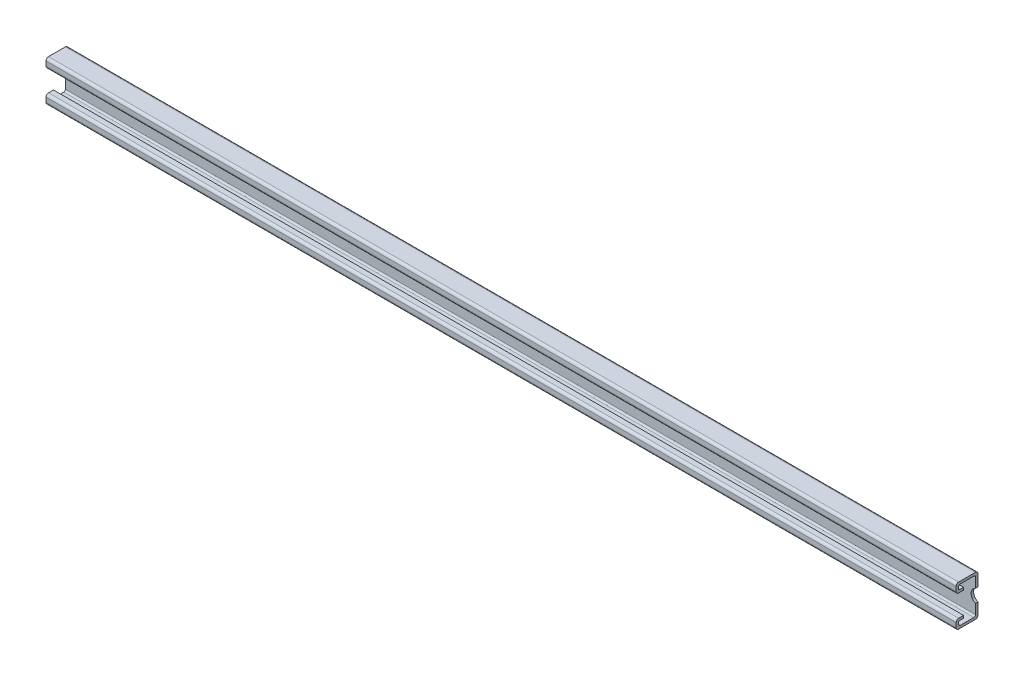
from build123d import *

# Parameters (mm, degrees)
SKETCH1_W           = 1000
SKETCH1_H           = 41
BOSS_EXTRUDE1_DEPTH = 22
CUT_EXTRUDE1_DEPTH  = 1001.900594465
SKETCH3_W           = 1000
SKETCH3_H           = 2.5
BOSS_EXTRUDE2_DEPTH = 5
CUT_EXTRUDE2_DEPTH  = 1002.08191473
CUT_EXTRUDE3_DEPTH  = 1002.08191473
CUT_EXTRUDE4_DEPTH  = 1002.08191473
CUT_EXTRUDE5_DEPTH  = 1002.08191473
CUT_EXTRUDE6_DEPTH  = 1002.08191473
CUT_EXTRUDE7_DEPTH  = 1002.08191473
CUT_EXTRUDE8_DEPTH  = 1002.08191473
CUT_EXTRUDE9_DEPTH  = 1002.08191473
CUT_EXTRUDE10_DEPTH = 1002.08191473
CUT_EXTRUDE11_DEPTH = 1002.08191473
CUT_EXTRUDE12_DEPTH = 1002.08191473
CUT_EXTRUDE13_DEPTH = 1002.08191473
CUT_EXTRUDE14_DEPTH = 1002.08191473
CUT_EXTRUDE15_DEPTH = 1002.08191473
CUT_EXTRUDE16_DEPTH = 1002.08191473
CUT_EXTRUDE17_DEPTH = 1002.08191473
CUT_EXTRUDE18_DEPTH = 1002.08191473
CUT_EXTRUDE19_DEPTH = 1002.08191473
CUT_EXTRUDE20_DEPTH = 1002.08191473
CUT_EXTRUDE21_DEPTH = 1002.08191473
FILLET1_R           = 1.2
FILLET2_R           = 1.6
FILLET3_R           = 2.5
SKETCH24_W          = 85.6
SKETCH24_H          = 22
CUT_EXTRUDE22_DEPTH = 1001.900594465


with BuildPart() as part:
    # Sketch1 → Boss-Extrude1 (new body)
    with BuildSketch(Plane(origin=(0, 0, -11), x_dir=(-1, 0, 0), z_dir=(0, 0, -1))):
        with Locations((-500, 20.5)):
            Rectangle(SKETCH1_W, SKETCH1_H)
    extrude(amount=-BOSS_EXTRUDE1_DEPTH)

    # Sketch2 → Cut-Extrude1 (cut, through all)
    with BuildSketch(Plane(origin=(1000, 0, 0), x_dir=(0, 0, -1), z_dir=(1, 0, 0))):
        Polygon((-11, 9.5), (-3.5, 9.5), (-3.5, 7), (-8.5, 7), (-8.5, 2.5), (8.5, 2.5), (8.5, 38.5), (-8.5, 38.5), (-8.5, 31.5), (-11, 31.5), align=None)
    extrude(amount=-CUT_EXTRUDE1_DEPTH, mode=Mode.SUBTRACT)

    # Sketch3 → Boss-Extrude2 (add)
    with BuildSketch(Plane(origin=(0, 0, 8.5), x_dir=(-1, 0, 0), z_dir=(0, 0, -1))):
        with Locations((-500, 32.75)):
            Rectangle(SKETCH3_W, SKETCH3_H)
    extrude(amount=BOSS_EXTRUDE2_DEPTH)

    # Sketch4 → Cut-Extrude2 (cut, through all)
    with BuildSketch(Plane(origin=(0, 0, -11), x_dir=(-1, 0, 0), z_dir=(0, 0, -1))):
        with BuildLine():
            Line((-117, 27.5), (-133, 27.5))
            ThreePointArc((-133, 27.5), (-140, 20.5), (-133, 13.5))
            Line((-133, 13.5), (-117, 13.5))
            ThreePointArc((-117, 13.5), (-110, 20.5), (-117, 27.5))
        make_face()
    extrude(amount=-CUT_EXTRUDE2_DEPTH, mode=Mode.SUBTRACT)

    # Sketch5 → Cut-Extrude3 (cut, through all)
    with BuildSketch(Plane(origin=(0, 0, -11), x_dir=(-1, 0, 0), z_dir=(0, 0, -1))):
        with BuildLine():
            Line((-217, 27.5), (-233, 27.5))
            ThreePointArc((-233, 27.5), (-240, 20.5), (-233, 13.5))
            Line((-233, 13.5), (-217, 13.5))
            ThreePointArc((-217, 13.5), (-210, 20.5), (-217, 27.5))
        make_face()
    extrude(amount=-CUT_EXTRUDE3_DEPTH, mode=Mode.SUBTRACT)

    # Sketch6 → Cut-Extrude4 (cut, through all)
    with BuildSketch(Plane(origin=(0, 0, -11), x_dir=(-1, 0, 0), z_dir=(0, 0, -1))):
        with BuildLine():
            Line((-317, 27.5), (-333, 27.5))
            ThreePointArc((-333, 27.5), (-340, 20.5), (-333, 13.5))
            Line((-333, 13.5), (-317, 13.5))
            ThreePointArc((-317, 13.5), (-310, 20.5), (-317, 27.5))
        make_face()
    extrude(amount=-CUT_EXTRUDE4_DEPTH, mode=Mode.SUBTRACT)

    # Sketch7 → Cut-Extrude5 (cut, through all)
    with BuildSketch(Plane(origin=(0, 0, -11), x_dir=(-1, 0, 0), z_dir=(0, 0, -1))):
        with BuildLine():
            Line((-417, 27.5), (-433, 27.5))
            ThreePointArc((-433, 27.5), (-440, 20.5), (-433, 13.5))
            Line((-433, 13.5), (-417, 13.5))
            ThreePointArc((-417, 13.5), (-410, 20.5), (-417, 27.5))
        make_face()
    extrude(amount=-CUT_EXTRUDE5_DEPTH, mode=Mode.SUBTRACT)

    # Sketch8 → Cut-Extrude6 (cut, through all)
    with BuildSketch(Plane(origin=(0, 0, -11), x_dir=(-1, 0, 0), z_dir=(0, 0, -1))):
        with BuildLine():
            Line((-517, 27.5), (-533, 27.5))
            ThreePointArc((-533, 27.5), (-540, 20.5), (-533, 13.5))
            Line((-533, 13.5), (-517, 13.5))
            ThreePointArc((-517, 13.5), (-510, 20.5), (-517, 27.5))
        make_face()
    extrude(amount=-CUT_EXTRUDE6_DEPTH, mode=Mode.SUBTRACT)

    # Sketch9 → Cut-Extrude7 (cut, through all)
    with BuildSketch(Plane(origin=(0, 0, -11), x_dir=(-1, 0, 0), z_dir=(0, 0, -1))):
        with BuildLine():
            Line((-617, 27.5), (-633, 27.5))
            ThreePointArc((-633, 27.5), (-640, 20.5), (-633, 13.5))
            Line((-633, 13.5), (-617, 13.5))
            ThreePointArc((-617, 13.5), (-610, 20.5), (-617, 27.5))
        make_face()
    extrude(amount=-CUT_EXTRUDE7_DEPTH, mode=Mode.SUBTRACT)

    # Sketch10 → Cut-Extrude8 (cut, through all)
    with BuildSketch(Plane(origin=(0, 0, -11), x_dir=(-1, 0, 0), z_dir=(0, 0, -1))):
        with BuildLine():
            Line((-717, 27.5), (-733, 27.5))
            ThreePointArc((-733, 27.5), (-740, 20.5), (-733, 13.5))
            Line((-733, 13.5), (-717, 13.5))
            ThreePointArc((-717, 13.5), (-710, 20.5), (-717, 27.5))
        make_face()
    extrude(amount=-CUT_EXTRUDE8_DEPTH, mode=Mode.SUBTRACT)

    # Sketch11 → Cut-Extrude9 (cut, through all)
    with BuildSketch(Plane(origin=(0, 0, -11), x_dir=(-1, 0, 0), z_dir=(0, 0, -1))):
        with BuildLine():
            Line((-817, 27.5), (-833, 27.5))
            ThreePointArc((-833, 27.5), (-840, 20.5), (-833, 13.5))
            Line((-833, 13.5), (-817, 13.5))
            ThreePointArc((-817, 13.5), (-810, 20.5), (-817, 27.5))
        make_face()
    extrude(amount=-CUT_EXTRUDE9_DEPTH, mode=Mode.SUBTRACT)

    # Sketch12 → Cut-Extrude10 (cut, through all)
    with BuildSketch(Plane(origin=(0, 0, -11), x_dir=(-1, 0, 0), z_dir=(0, 0, -1))):
        with BuildLine():
            Line((-917, 27.5), (-933, 27.5))
            ThreePointArc((-933, 27.5), (-940, 20.5), (-933, 13.5))
            Line((-933, 13.5), (-917, 13.5))
            ThreePointArc((-917, 13.5), (-910, 20.5), (-917, 27.5))
        make_face()
    extrude(amount=-CUT_EXTRUDE10_DEPTH, mode=Mode.SUBTRACT)

    # Sketch13 → Cut-Extrude11 (cut, through all)
    with BuildSketch(Plane(origin=(0, 0, -11), x_dir=(-1, 0, 0), z_dir=(0, 0, -1))):
        with BuildLine():
            Line((-17, 27.5), (-33, 27.5))
            ThreePointArc((-33, 27.5), (-40, 20.5), (-33, 13.5))
            Line((-33, 13.5), (-17, 13.5))
            ThreePointArc((-17, 13.5), (-10, 20.5), (-17, 27.5))
        make_face()
    extrude(amount=-CUT_EXTRUDE11_DEPTH, mode=Mode.SUBTRACT)

    # Sketch14 → Cut-Extrude12 (cut, through all)
    with BuildSketch(Plane(origin=(0, 0, -11), x_dir=(-1, 0, 0), z_dir=(0, 0, -1))):
        with BuildLine():
            Line((-967, 27.5), (-983, 27.5))
            ThreePointArc((-983, 27.5), (-990, 20.5), (-983, 13.5))
            Line((-983, 13.5), (-967, 13.5))
            ThreePointArc((-967, 13.5), (-960, 20.5), (-967, 27.5))
        make_face()
    extrude(amount=-CUT_EXTRUDE12_DEPTH, mode=Mode.SUBTRACT)

    # Sketch15 → Cut-Extrude13 (cut, through all)
    with BuildSketch(Plane(origin=(0, 0, -11), x_dir=(-1, 0, 0), z_dir=(0, 0, -1))):
        with BuildLine():
            Line((-867, 27.5), (-883, 27.5))
            ThreePointArc((-883, 27.5), (-890, 20.5), (-883, 13.5))
            Line((-883, 13.5), (-867, 13.5))
            ThreePointArc((-867, 13.5), (-860, 20.5), (-867, 27.5))
        make_face()
    extrude(amount=-CUT_EXTRUDE13_DEPTH, mode=Mode.SUBTRACT)

    # Sketch16 → Cut-Extrude14 (cut, through all)
    with BuildSketch(Plane(origin=(0, 0, -11), x_dir=(-1, 0, 0), z_dir=(0, 0, -1))):
        with BuildLine():
            Line((-767, 27.5), (-783, 27.5))
            ThreePointArc((-783, 27.5), (-790, 20.5), (-783, 13.5))
            Line((-783, 13.5), (-767, 13.5))
            ThreePointArc((-767, 13.5), (-760, 20.5), (-767, 27.5))
        make_face()
    extrude(amount=-CUT_EXTRUDE14_DEPTH, mode=Mode.SUBTRACT)

    # Sketch17 → Cut-Extrude15 (cut, through all)
    with BuildSketch(Plane(origin=(0, 0, -11), x_dir=(-1, 0, 0), z_dir=(0, 0, -1))):
        with BuildLine():
            Line((-667, 27.5), (-683, 27.5))
            ThreePointArc((-683, 27.5), (-690, 20.5), (-683, 13.5))
            Line((-683, 13.5), (-667, 13.5))
            ThreePointArc((-667, 13.5), (-660, 20.5), (-667, 27.5))
        make_face()
    extrude(amount=-CUT_EXTRUDE15_DEPTH, mode=Mode.SUBTRACT)

    # Sketch18 → Cut-Extrude16 (cut, through all)
    with BuildSketch(Plane(origin=(0, 0, -11), x_dir=(-1, 0, 0), z_dir=(0, 0, -1))):
        with BuildLine():
            Line((-567, 27.5), (-583, 27.5))
            ThreePointArc((-583, 27.5), (-590, 20.5), (-583, 13.5))
            Line((-583, 13.5), (-567, 13.5))
            ThreePointArc((-567, 13.5), (-560, 20.5), (-567, 27.5))
        make_face()
    extrude(amount=-CUT_EXTRUDE16_DEPTH, mode=Mode.SUBTRACT)

    # Sketch19 → Cut-Extrude17 (cut, through all)
    with BuildSketch(Plane(origin=(0, 0, -11), x_dir=(-1, 0, 0), z_dir=(0, 0, -1))):
        with BuildLine():
            Line((-467, 27.5), (-483, 27.5))
            ThreePointArc((-483, 27.5), (-490, 20.5), (-483, 13.5))
            Line((-483, 13.5), (-467, 13.5))
            ThreePointArc((-467, 13.5), (-460, 20.5), (-467, 27.5))
        make_face()
    extrude(amount=-CUT_EXTRUDE17_DEPTH, mode=Mode.SUBTRACT)

    # Sketch20 → Cut-Extrude18 (cut, through all)
    with BuildSketch(Plane(origin=(0, 0, -11), x_dir=(-1, 0, 0), z_dir=(0, 0, -1))):
        with BuildLine():
            Line((-367, 27.5), (-383, 27.5))
            ThreePointArc((-383, 27.5), (-390, 20.5), (-383, 13.5))
            Line((-383, 13.5), (-367, 13.5))
            ThreePointArc((-367, 13.5), (-360, 20.5), (-367, 27.5))
        make_face()
    extrude(amount=-CUT_EXTRUDE18_DEPTH, mode=Mode.SUBTRACT)

    # Sketch21 → Cut-Extrude19 (cut, through all)
    with BuildSketch(Plane(origin=(0, 0, -11), x_dir=(-1, 0, 0), z_dir=(0, 0, -1))):
        with BuildLine():
            Line((-267, 27.5), (-283, 27.5))
            ThreePointArc((-283, 27.5), (-290, 20.5), (-283, 13.5))
            Line((-283, 13.5), (-267, 13.5))
            ThreePointArc((-267, 13.5), (-260, 20.5), (-267, 27.5))
        make_face()
    extrude(amount=-CUT_EXTRUDE19_DEPTH, mode=Mode.SUBTRACT)

    # Sketch22 → Cut-Extrude20 (cut, through all)
    with BuildSketch(Plane(origin=(0, 0, -11), x_dir=(-1, 0, 0), z_dir=(0, 0, -1))):
        with BuildLine():
            Line((-167, 27.5), (-183, 27.5))
            ThreePointArc((-183, 27.5), (-190, 20.5), (-183, 13.5))
            Line((-183, 13.5), (-167, 13.5))
            ThreePointArc((-167, 13.5), (-160, 20.5), (-167, 27.5))
        make_face()
    extrude(amount=-CUT_EXTRUDE20_DEPTH, mode=Mode.SUBTRACT)

    # Sketch23 → Cut-Extrude21 (cut, through all)
    with BuildSketch(Plane(origin=(0, 0, -11), x_dir=(-1, 0, 0), z_dir=(0, 0, -1))):
        with BuildLine():
            Line((-67, 27.5), (-83, 27.5))
            ThreePointArc((-83, 27.5), (-90, 20.5), (-83, 13.5))
            Line((-83, 13.5), (-67, 13.5))
            ThreePointArc((-67, 13.5), (-60, 20.5), (-67, 27.5))
        make_face()
    extrude(amount=-CUT_EXTRUDE21_DEPTH, mode=Mode.SUBTRACT)

    # Fillet1
    fillet1_edges = [part.edges().sort_by_distance(p)[0] for p in [
        (500, 7, 8.5),
        (500, 34, 8.5),
    ]]
    fillet(fillet1_edges, radius=FILLET1_R)

    # Fillet2
    fillet2_edges = [part.edges().sort_by_distance(p)[0] for p in [
        (500, 2.5, -8.5),
        (500, 38.5, 8.5),
        (500, 38.5, -8.5),
        (500, 2.5, 8.5),
    ]]
    fillet(fillet2_edges, radius=FILLET2_R)

    # Fillet3
    fillet3_edges = [part.edges().sort_by_distance(p)[0] for p in [
        (500, 0, -11),
        (500, 31.5, 11),
        (500, 9.5, 11),
        (500, 41, 11),
        (500, 41, -11),
        (500, 0, 11),
    ]]
    fillet(fillet3_edges, radius=FILLET3_R)

    # Sketch24 → Cut-Extrude22 (cut, through all)
    with BuildSketch(Plane(origin=(0, 41, 0), x_dir=(1, 0, 0), z_dir=(0, 1, 0))):
        with Locations((957.2, 0)):
            Rectangle(SKETCH24_W, SKETCH24_H)
    extrude(amount=-CUT_EXTRUDE22_DEPTH, mode=Mode.SUBTRACT)


solid = part.part
